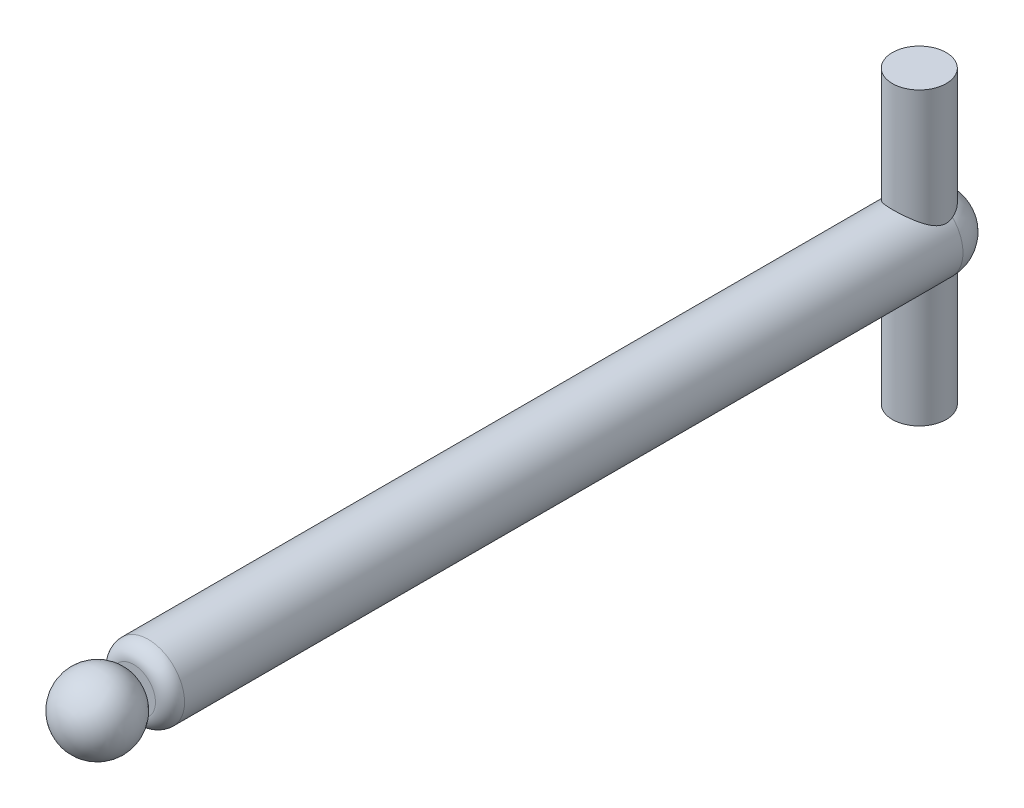
from build123d import *

# Parameters (mm, degrees)
SKETCH1_R                = 2.5
BOSS_EXTRUDE1_DEPTH      = 57
SKETCH3_W                = 1.5
SKETCH3_H                = 1.928249817
FILLET1_R                = 1
BOSS_EXTRUDE2_DEPTH      = 10
BOSS_EXTRUDE2_DEPTH_BACK = 10
SKETCH4_R                = 1.85
FILLET2_R                = 2.5


with BuildPart() as part:
    # Sketch1 → Boss-Extrude1 (new body)
    with BuildSketch(Plane.XY):
        with Locations(Location((0, 0, 0), (0, 0, 180))):
            Circle(SKETCH1_R)
    extrude(amount=BOSS_EXTRUDE1_DEPTH)

    # Fillet1
    fillet1_edges = [part.edges().sort_by_distance(p)[0] for p in [
        (2.5, 0, 57),
    ]]
    fillet(fillet1_edges, radius=FILLET1_R)

    # Sketch4 → Boss-Extrude2 (add, two sides: drawn at the far end of the back side and taken through both)
    with BuildSketch(Plane(origin=(0, 0, 0), x_dir=(1, 0, 0), z_dir=(0, 1, 0)).offset(-BOSS_EXTRUDE2_DEPTH_BACK)):
        with Locations(Location((0, -3, 0), (0, 0, 270))):
            Circle(SKETCH4_R)
    extrude(amount=BOSS_EXTRUDE2_DEPTH + BOSS_EXTRUDE2_DEPTH_BACK)

    # Fillet2
    # the kernel refuses this fillet: 2.5 mm, written as the material it takes off along each edge
    with BuildSketch(Plane(origin=(0, 0, 0), x_dir=(-1, 0, 0), z_dir=(0, 1, 0))) as fillet2_piece_1_section:
        with BuildLine():
            CenterArc((2.5 - FILLET2_R, FILLET2_R), FILLET2_R, 270, 90)
            Line((2.5 - FILLET2_R, 0), (2.5, 0))
            Line((2.5, 0), (2.5, FILLET2_R))
        make_face()
    fillet2_piece_1 = revolve(axis=Axis((0, 0, 0), (0, 0, 1)), mode=Mode.PRIVATE)
    fillet2_piece_1 = fillet2_piece_1 - Plane(origin=(0, 0, 3), x_dir=(0, 0, 1), z_dir=(0, -1, 0)) * Cylinder(1.85, 10, mode=Mode.PRIVATE)
    add(fillet2_piece_1, mode=Mode.SUBTRACT)


with BuildPart() as body_2:
    # Sketch3 → Revolve1 (revolve)
    with BuildSketch(Plane(origin=(0, 0, 0), x_dir=(1, 0, 0), z_dir=(0, 1, 0)), mode=Mode.PRIVATE) as revolve1_sk:
        with BuildLine():
            Line((0, -57), (0, -62))
            ThreePointArc((0, -62), (-2.5, -59.5), (0, -57))
        make_face()
        with Locations((-0.75, -28.876426737)):
            Rectangle(SKETCH3_W, SKETCH3_H)
    revolve(revolve1_sk.sketch.rotate(Axis((0, 0, 57), (0, 0, 1)), 180), axis=Axis((0, 0, 57), (0, 0, 1)))


solid = Compound([part.part, body_2.part])
